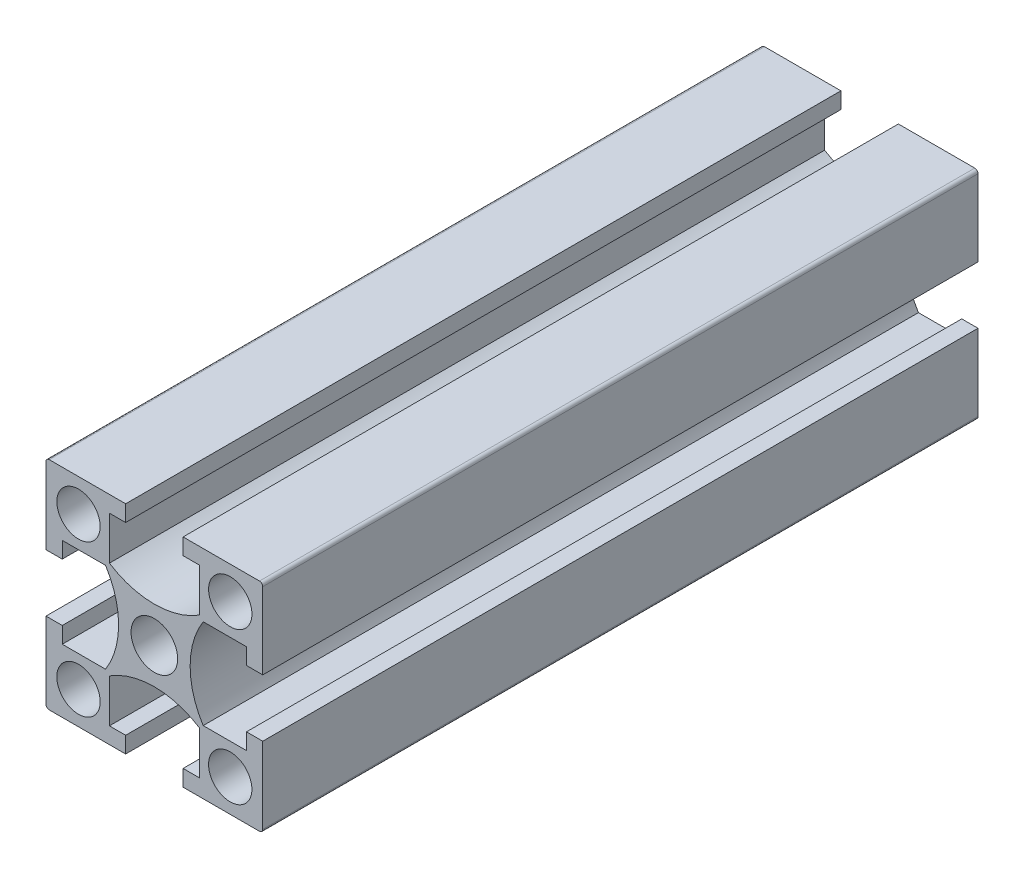
from build123d import *

# Parameters (mm, degrees)
SKETCH_1_W               = 20
SKETCH_1_H               = 20
SKETCH_1_R               = 2
SKETCH_1_R_2             = 2.15
EXTRUDE_1_DEPTH          = 66
CUT_EXTRUDE_1_REACH      = 69.498
PATTERN_CIRCULAR_1_COUNT = 4
FILLET_1_R               = 0.3
SKETCH_3_R               = 2.5
CUT_EXTRUDE_2_DEPTH      = 70.685005561


with BuildPart() as part:
    # 스케치1 → 보스-돌출1 (new body)
    with BuildSketch(Plane.XY):
        Rectangle(SKETCH_1_W, SKETCH_1_H)
        with Locations((-7, -7)):
            Circle(SKETCH_1_R, mode=Mode.SUBTRACT)
        with Locations((7, -7)):
            Circle(SKETCH_1_R, mode=Mode.SUBTRACT)
        with Locations((-7, 7)):
            Circle(SKETCH_1_R, mode=Mode.SUBTRACT)
        Circle(SKETCH_1_R_2, mode=Mode.SUBTRACT)
        with Locations((7, 7)):
            Circle(SKETCH_1_R, mode=Mode.SUBTRACT)
    extrude(amount=EXTRUDE_1_DEPTH)

    # 스케치1<3> → 컷-돌출1 (cut, up to next)
    with BuildSketch(Plane.XY, mode=Mode.PRIVATE) as cut_extrude_1_sk1:
        with BuildLine():
            Line((-8.5, 2.65), (-10, 2.65))
            Line((-10, 2.65), (-10, -2.65))
            Line((-10, -2.65), (-8.5, -2.65))
            Line((-8.5, -2.65), (-8.5, -4.15))
            Line((-8.5, -4.15), (-4.503166667, -4.15))
            ThreePointArc((-4.503166667, -4.15), (-3.3, 0), (-4.503166667, 4.15))
            Line((-4.503166667, 4.15), (-8.5, 4.15))
            Line((-8.5, 4.15), (-8.5, 2.65))
        make_face()
    cut_extrude_1_tool1 = extrude(cut_extrude_1_sk1.sketch, amount=CUT_EXTRUDE_1_REACH, mode=Mode.PRIVATE) & part.part
    cut_extrude_1 = cut_extrude_1_tool1.solids().sort_by_distance((-6.606913, 0, 0))[0]
    add(cut_extrude_1, mode=Mode.SUBTRACT)

    # 원형 패턴1: 컷-돌출1 ×4 about axis
    pattern_circular_1_axis = Axis((0, 0, 66), (0, 0, -1))
    for i in range(1, PATTERN_CIRCULAR_1_COUNT):
        add(cut_extrude_1.rotate(pattern_circular_1_axis, i * 360 / PATTERN_CIRCULAR_1_COUNT), mode=Mode.SUBTRACT)

    # 필렛1
    fillet_1_edges = [part.edges().sort_by_distance(p)[0] for p in [
        (10, -10, 33),
        (-10, -10, 33),
        (-10, 10, 33),
        (10, 10, 33),
    ]]
    fillet(fillet_1_edges, radius=FILLET_1_R)

    # 스케치3 → 컷-돌출2 (cut, through all)
    with BuildSketch(Plane(origin=(0, 10, 0), x_dir=(1, 0, 0), z_dir=(0, 1, 0))):
        with Locations((0, -55)):
            Circle(SKETCH_3_R)
        with Locations((0, -11)):
            Circle(SKETCH_3_R)
    extrude(amount=-CUT_EXTRUDE_2_DEPTH, mode=Mode.SUBTRACT)


solid = part.part
